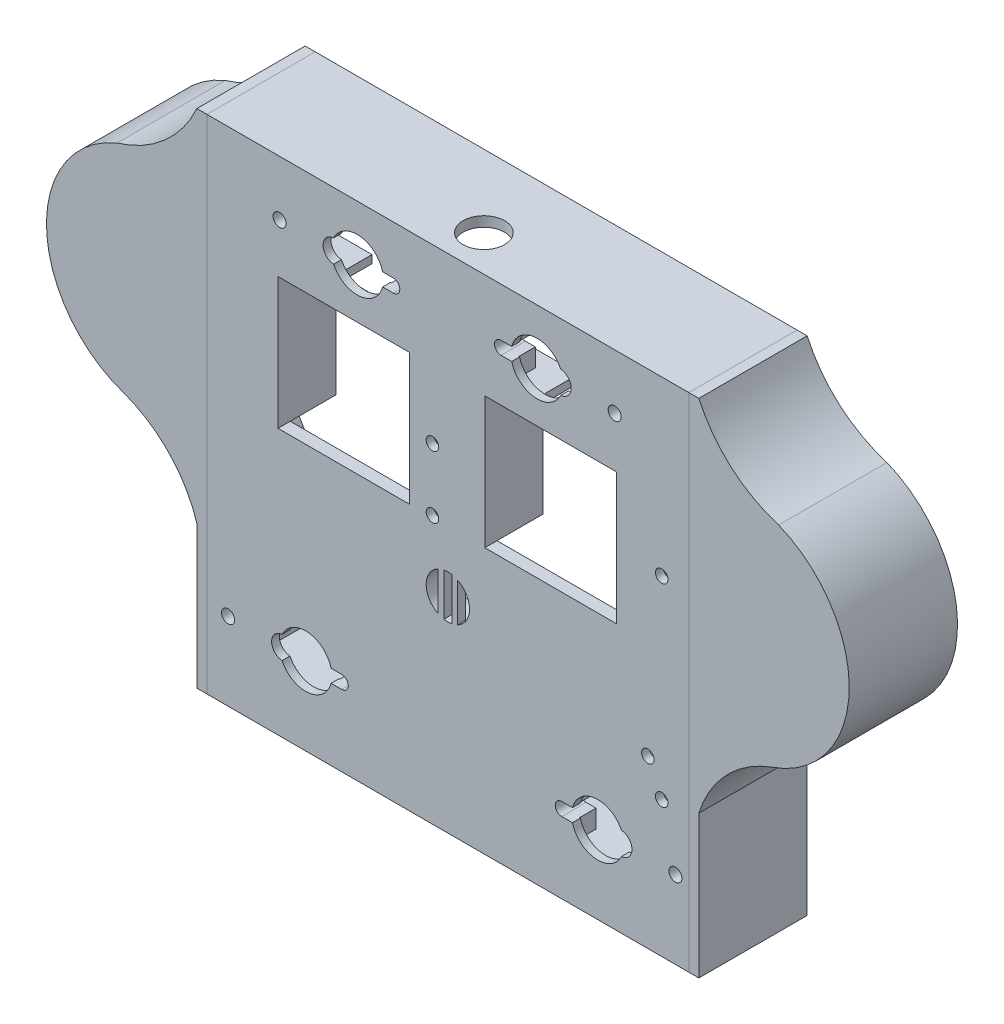
from build123d import *

# Parameters (mm, degrees)
SKETCH1_W                    = 127.00000000000001
SKETCH1_H                    = 127.00000000000001
BOSS_EXTRUDE1_DEPTH          = 2
BOSS_EXTRUDE2_DEPTH          = 2
BOSS_EXTRUDE3_START          = 25.4
BOSS_EXTRUDE3_DEPTH          = 25.4
CUT_EXTRUDE1_DEPTH           = 211.04755300039534
BOSS_EXTRUDE4_START          = -2
BOSS_EXTRUDE4_OUTLINE_W      = 33.269999999999996
BOSS_EXTRUDE4_OUTLINE_H      = 33.270000000000024
BOSS_EXTRUDE4_DEPTH          = 2
BOSS_EXTRUDE4_2_OUTLINE_W    = 5.079999999999998
BOSS_EXTRUDE4_2_OUTLINE_H    = 12.5
BOSS_EXTRUDE4_2_OUTLINE_W_2  = 5.080000000000027
BOSS_EXTRUDE4_2_OUTLINE_W_3  = 5.625874353
BOSS_EXTRUDE4_2_OUTLINE_H_2  = 12.499999999999998
BOSS_EXTRUDE4_2_OUTLINE_W_4  = 5.0800000000000125
BOSS_EXTRUDE4_2_OUTLINE_W_5  = 7.608246930999999
BOSS_EXTRUDE4_2_DEPTH        = 4.18
CUT_EXTRUDE5_START           = -6.18
CUT_EXTRUDE5_OUTLINE_R       = 1.651
CUT_EXTRUDE5_DEPTH           = 6.18
BOSS_EXTRUDE5_DEPTH          = 12.7
BOSS_EXTRUDE6_DEPTH          = 1.089599898
SKETCH14_W                   = 9.143999999999977
SKETCH14_H                   = 9.143999999999984
SKETCH14_R                   = 1.0921999999999987
SKETCH14_W_2                 = 7.387447767273962
SKETCH14_H_2                 = 9.143999999999977
SKETCH14_W_3                 = 7.351052232726062
SKETCH14_H_3                 = 9.143999999999991
SKETCH14_R_2                 = 1.092200000000002
BOSS_EXTRUDE8_DEPTH          = 9.598599898
BOSS_EXTRUDE10_START         = 4.064
BOSS_EXTRUDE10_OUTLINE_W     = 15.081000000000003
BOSS_EXTRUDE10_OUTLINE_H     = 2
BOSS_EXTRUDE10_DEPTH         = 8.636
BOSS_EXTRUDE10_2_OUTLINE_R   = 7.485
BOSS_EXTRUDE10_2_OUTLINE_R_2 = 5.485
BOSS_EXTRUDE10_2_DEPTH       = 5
CUT_EXTRUDE13_DEPTH          = 210.7960307571473
SKETCH18_W                   = 25.57999999999999
SKETCH18_H                   = 11.165
BOSS_EXTRUDE12_DEPTH         = 5
SKETCH23_W                   = 1.9050000000000011
SKETCH23_H                   = 11.165
BOSS_EXTRUDE14_DEPTH         = 2.54
SKETCH22_R                   = 5.2500000000000036
CUT_EXTRUDE14_DEPTH          = 209.52162027342368
SKETCH24_R                   = 1.5874999999999853
SKETCH24_R_2                 = 1.5874999999999986
CUT_EXTRUDE19_DEPTH          = 210.7960307571473
SKETCH25_R                   = 1.5874999999999986
SKETCH25_R_2                 = 1.5874999999999853
CUT_EXTRUDE20_DEPTH          = 210.7960307571473
SPLIT2_START                 = -27.4
SPLIT2_DEPTH                 = 27.4
SPLIT2_START_2               = -2
SPLIT2_2_DEPTH               = 2
SPLIT2_START_3               = -38.046098171
SPLIT2_3_DEPTH               = 40.586098171
SPLIT2_START_4               = 124.46
SPLIT2_4_DEPTH               = 40.586098171
SPLIT2_5_DEPTH               = 27.4
SPLIT2_6_DEPTH               = 2


# Read off the part's stored shape, not the designer's step: Boss-Extrude4, Cut-Extrude5, Boss-Extrude10, Split2
with BuildPart() as part:
    # Sketch1 → Boss-Extrude1 (new body)
    with BuildSketch(Plane.XY):
        with Locations((63.50000000000001, 63.50000000000001)):
            Rectangle(SKETCH1_W, SKETCH1_H)
    extrude(amount=-BOSS_EXTRUDE1_DEPTH)

    # Sketch4 → Boss-Extrude2 (add)
    with BuildSketch(Plane(origin=(0, 0, -2), x_dir=(-1, 0, 0), z_dir=(0, 0, -1))):
        with BuildLine():
            Line((-127, 109.98389429764997), (-127, 127))
            ThreePointArc((-127, 127), (-134.06423055053074, 117.00265834317705), (-144.33984712949783, 110.34969679238205))
            ThreePointArc((-144.3398471294978, 110.34969679238199), (-135.64173000356203, 111.50323268817304), (-127.00000000000034, 109.98389429764987))
        make_face()
        with BuildLine():
            Line((-127, 55.441382730095796), (-127, 109.98389429764997))
            ThreePointArc((-127.00000000000034, 109.98389429764987), (-135.64173000356203, 111.50323268817304), (-144.3398471294978, 110.34969679238199))
            ThreePointArc((-144.33984712949783, 110.34969679238205), (-145.75390374238242, 109.81636694945792), (-147.19134681661998, 109.34972550881787))
            ThreePointArc((-147.19134681661998, 109.34972550881787), (-165.03026565382407, 81.75785721819155), (-145.401924231689, 55.40892110942765))
            ThreePointArc((-145.401924231689, 55.40892110942765), (-136.1982993618574, 53.91568331925208), (-127.00000000000024, 55.44138273009586))
        make_face()
        with BuildLine():
            Line((-127, 109.98389429764997), (-127, 127))
            ThreePointArc((-127, 127), (-134.06423055053074, 117.00265834317705), (-144.33984712949783, 110.34969679238205))
            ThreePointArc((-144.3398471294978, 110.34969679238199), (-135.64173000356203, 111.50323268817304), (-127.00000000000034, 109.98389429764987))
        make_face()
        with BuildLine():
            Line((-127, 55.441382730095796), (-127, 109.98389429764997))
            ThreePointArc((-127.00000000000034, 109.98389429764987), (-135.64173000356203, 111.50323268817304), (-144.3398471294978, 110.34969679238199))
            ThreePointArc((-144.33984712949783, 110.34969679238205), (-145.75390374238242, 109.81636694945792), (-147.19134681661998, 109.34972550881787))
            ThreePointArc((-147.19134681661998, 109.34972550881787), (-165.03026565382407, 81.75785721819155), (-145.401924231689, 55.40892110942765))
            ThreePointArc((-145.401924231689, 55.40892110942765), (-136.1982993618574, 53.91568331925208), (-127.00000000000024, 55.44138273009586))
        make_face()
        with BuildLine():
            ThreePointArc((-145.401924231689, 55.40892110942764), (-133.95065083940247, 47.9093928466553), (-127, 36.11689356203695))
            Line((-127, 36.11689356203695), (-127, 55.441382730095796))
            ThreePointArc((-127.00000000000024, 55.44138273009586), (-136.1982993618574, 53.91568331925208), (-145.401924231689, 55.40892110942765))
        make_face()
    boss_extrude2 = extrude(amount=-BOSS_EXTRUDE2_DEPTH)

    # Mirror1: Boss-Extrude2 across plane
    add(boss_extrude2.mirror(Plane(origin=(63.5, 0, 0), x_dir=(0, 0, 1), z_dir=(1, 0, 0))))

    # Sketch5 → Boss-Extrude3 (add)
    with BuildSketch(Plane(origin=(0, 0, -2), x_dir=(-1, 0, 0), z_dir=(0, 0, -1)).offset(BOSS_EXTRUDE3_START)):
        with BuildLine():
            Line((0, 0), (0, 36.11689356203696))
            ThreePointArc((0, 36.11689356203696), (6.950650839402837, 47.909392846655656), (18.40192423168996, 55.40892110942798))
            ThreePointArc((18.40192423168996, 55.40892110942798), (38.03026565382408, 81.75785721819206), (20.191346816619987, 109.34972550881787))
            ThreePointArc((20.191346816619987, 109.34972550881787), (8.17850440054783, 115.98168301881103), (-3.47e-15, 127))
            Line((-3.47e-15, 127), (-127, 127))
            ThreePointArc((-127, 127), (-135.1785044005478, 115.98168301881103), (-147.19134681661998, 109.34972550881785))
            ThreePointArc((-147.19134681661998, 109.34972550881785), (-165.03026565382407, 81.75785721819206), (-145.40192423168997, 55.40892110942798))
            ThreePointArc((-145.40192423168997, 55.40892110942798), (-133.95065083940284, 47.90939284665566), (-127, 36.11689356203696))
            Line((-127, 36.11689356203696), (-127, 0))
            Line((-127, 0), (0, 0))
        make_face()
        with BuildLine():
            Line((-2.54, 2.54), (-2.54, 36.49717237208901))
            ThreePointArc((-2.54, 36.49717237208901), (4.988828741492426, 49.53196201137023), (17.56329445807016, 57.806731802829454))
            ThreePointArc((17.56329445807016, 57.806731802829454), (35.488998344648195, 81.76517459677275), (19.33789400089523, 106.95405447296278))
            ThreePointArc((19.33789400089523, 106.95405447296278), (7.086783976529961, 113.57345274602841), (-1.59591256392396, 124.46000000000001))
            Line((-1.59591256392396, 124.46000000000001), (-125.40408743607604, 124.46000000000001))
            ThreePointArc((-125.40408743607604, 124.46000000000001), (-134.08678397652994, 113.57345274602842), (-146.3378940008952, 106.95405447296281))
            ThreePointArc((-146.3378940008952, 106.95405447296281), (-162.48899834464805, 81.76517459677285), (-144.5632944580703, 57.8067318028295))
            ThreePointArc((-144.5632944580703, 57.8067318028295), (-131.98882874149245, 49.53196201137028), (-124.46000000000001, 36.49717237208901))
            Line((-124.46000000000001, 36.49717237208901), (-124.46000000000001, 2.54))
            Line((-124.46000000000001, 2.54), (-2.54, 2.54))
        make_face(mode=Mode.SUBTRACT)
    extrude(amount=-BOSS_EXTRUDE3_DEPTH)

    # Sketch6 → Cut-Extrude1 (cut, through all)
    with BuildSketch(Plane.XY):
        with BuildLine():
            ThreePointArc((92.05979136316081, 115.93690455448572), (79.45205223272606, 113.0648407726853), (92.05979136316081, 110.19277699088488))
            ThreePointArc((92.05979136316081, 110.19277699088488), (94.71405223272606, 113.0648407726853), (92.05979136316081, 115.93690455448572))
        make_face()
        with BuildLine():
            ThreePointArc((34.58631310229128, 110.1927769908849), (47.194052232726065, 113.0648407726853), (34.58631310229128, 115.93690455448572))
            ThreePointArc((34.58631310229128, 115.93690455448572), (31.932052232726047, 113.0648407726853), (34.58631310229128, 110.1927769908849))
        make_face()
        with BuildLine():
            ThreePointArc((21.556507801045413, 16.822606859552092), (34.1642469314802, 19.694670641352506), (21.556507801045413, 22.56673442315292))
            ThreePointArc((21.556507801045413, 22.56673442315292), (18.902246931480185, 19.694670641352506), (21.556507801045413, 16.822606859552092))
        make_face()
        with BuildLine():
            ThreePointArc((107.42586477707393, 22.566734423152884), (94.81812564663917, 19.69467064135247), (107.42586477707393, 16.822606859552057))
            ThreePointArc((107.42586477707393, 16.822606859552057), (110.08012564663916, 19.69467064135247), (107.42586477707393, 22.566734423152884))
        make_face()
    extrude(amount=-CUT_EXTRUDE1_DEPTH, mode=Mode.SUBTRACT)

    # Boss-Extrude4 outline → Boss-Extrude4 (cut)
    with BuildSketch(Plane(origin=(0, 0, -2), x_dir=(-1, 0, 0), z_dir=(0, 0, -1)).offset(BOSS_EXTRUDE4_START)):
        with Locations((-89.483052233, 83.829840773)):
            Rectangle(BOSS_EXTRUDE4_OUTLINE_W, BOSS_EXTRUDE4_OUTLINE_H)
        with Locations((-37.163052233, 83.829840773)):
            Rectangle(BOSS_EXTRUDE4_OUTLINE_W, BOSS_EXTRUDE4_OUTLINE_H)
    extrude(amount=BOSS_EXTRUDE4_DEPTH, mode=Mode.SUBTRACT)

    # Boss-Extrude4 2 outline → Boss-Extrude4 2 (add)
    with BuildSketch(Plane(origin=(0, 0, -2), x_dir=(-1, 0, 0), z_dir=(0, 0, -1))):
        with Locations((-20.638052233, 113.064840773)):
            Rectangle(BOSS_EXTRUDE4_2_OUTLINE_W, BOSS_EXTRUDE4_2_OUTLINE_H)
        with Locations((-49.734052233, 113.064840773)):
            Rectangle(BOSS_EXTRUDE4_2_OUTLINE_W, BOSS_EXTRUDE4_2_OUTLINE_H)
        with Locations((-76.912052233, 113.064840773)):
            Rectangle(BOSS_EXTRUDE4_2_OUTLINE_W, BOSS_EXTRUDE4_2_OUTLINE_H)
        with Locations((-106.008052233, 113.064840773)):
            Rectangle(BOSS_EXTRUDE4_2_OUTLINE_W_2, BOSS_EXTRUDE4_2_OUTLINE_H)
        with Locations((-121.6470628235, 19.694670641)):
            Rectangle(BOSS_EXTRUDE4_2_OUTLINE_W_3, BOSS_EXTRUDE4_2_OUTLINE_H_2)
        with Locations((-92.27812564700001, 19.694670641)):
            Rectangle(BOSS_EXTRUDE4_2_OUTLINE_W_4, BOSS_EXTRUDE4_2_OUTLINE_H_2)
        with Locations((-36.704246931, 19.694670641)):
            Rectangle(BOSS_EXTRUDE4_2_OUTLINE_W, BOSS_EXTRUDE4_2_OUTLINE_H_2)
        with Locations((-6.344123465499999, 19.694670641)):
            Rectangle(BOSS_EXTRUDE4_2_OUTLINE_W_5, BOSS_EXTRUDE4_2_OUTLINE_H_2)
    extrude(amount=BOSS_EXTRUDE4_2_DEPTH)

    # Cut-Extrude5 outline → Cut-Extrude5 (cut)
    with BuildSketch(Plane.XY.offset(CUT_EXTRUDE5_START)):
        with BuildLine():
            ThreePointArc((92.319125647, 21.345670641), (90.668125647, 19.694670641), (92.319125647, 18.043670641))
            Line((92.319125647, 18.043670641), (95.026948446, 18.043670641))
            ThreePointArc((95.026948446, 18.043670641), (94.818125647, 19.694670641), (95.026948446, 21.345670641))
            Line((95.026948446, 21.345670641), (92.319125647, 21.345670641))
        make_face()
        with BuildLine():
            ThreePointArc((36.663246931, 18.043670641), (38.314246931, 19.694670641), (36.663246931, 21.345670641))
            Line((36.663246931, 21.345670641), (33.955424132, 21.345670641))
            ThreePointArc((33.955424132, 21.345670641), (34.164246931, 19.694670641), (33.955424132, 18.043670641))
            Line((33.955424132, 18.043670641), (36.663246931, 18.043670641))
        make_face()
        with BuildLine():
            ThreePointArc((49.693052233, 111.413840773), (51.344052233, 113.064840773), (49.693052233, 114.715840773))
            Line((49.693052233, 114.715840773), (46.985229434, 114.715840773))
            ThreePointArc((46.985229434, 114.715840773), (47.194052233, 113.064840773), (46.985229434, 111.413840773))
            Line((46.985229434, 111.413840773), (49.693052233, 111.413840773))
        make_face()
        with Locations((121.079125647, 19.694670641)):
            Circle(CUT_EXTRUDE5_OUTLINE_R)
        with Locations((7.903246931, 19.694670641)):
            Circle(CUT_EXTRUDE5_OUTLINE_R)
        with Locations((20.933052233, 113.064840773)):
            Circle(CUT_EXTRUDE5_OUTLINE_R)
        with BuildLine():
            ThreePointArc((76.953052233, 114.715840773), (75.302052233, 113.064840773), (76.953052233, 111.413840773))
            Line((76.953052233, 111.413840773), (79.660875032, 111.413840773))
            ThreePointArc((79.660875032, 111.413840773), (79.452052233, 113.064840773), (79.660875032, 114.715840773))
            Line((79.660875032, 114.715840773), (76.953052233, 114.715840773))
        make_face()
        with Locations((105.713052233, 113.064840773)):
            Circle(CUT_EXTRUDE5_OUTLINE_R)
    extrude(amount=CUT_EXTRUDE5_DEPTH, mode=Mode.SUBTRACT)

    # Sketch12 → Boss-Extrude5 (add)
    with BuildSketch(Plane(origin=(0, 0, -2), x_dir=(-1, 0, 0), z_dir=(0, 0, -1))):
        Polygon((-72.84805223272609, 67.19484077268531), (-72.84805223272608, 100.46484077268529), (-106.11805223272609, 100.46484077268529), (-106.11805223272609, 67.1948407726853), (-108.11805223272609, 67.1948407726853), (-108.11805223272609, 102.46484077268529), (-70.84805223272609, 102.46484077268529), (-70.84805223272609, 67.19484077268531), align=None)
        Polygon((-20.528052232726047, 100.4648407726853), (-53.79805223272605, 100.4648407726853), (-53.79805223272604, 67.19484077268531), (-55.79805223272605, 67.19484077268531), (-55.79805223272606, 102.4648407726853), (-18.52805223272605, 102.4648407726853), (-18.52805223272605, 67.19484077268531), (-20.528052232726054, 67.19484077268531), align=None)
    extrude(amount=BOSS_EXTRUDE5_DEPTH)

    # Sketch13 → Boss-Extrude6 (add)
    with BuildSketch(Plane(origin=(0, 0, -2), x_dir=(-1, 0, 0), z_dir=(0, 0, -1))):
        Polygon((-55.79805223272605, 67.19484077268531), (-18.52805223272605, 67.19484077268531), (-18.528052232726047, 65.19484077268531), (-55.79805223272605, 65.19484077268531), align=None)
        Polygon((-108.11805223272609, 67.1948407726853), (-70.84805223272609, 67.19484077268531), (-70.84805223272609, 65.19484077268531), (-108.11805223272609, 65.19484077268531), align=None)
    extrude(amount=BOSS_EXTRUDE6_DEPTH)

    # Sketch14 → Boss-Extrude8 (add)
    # profile 1 of 4: a face of its own
    with BuildSketch(Plane(origin=(0, 0, -2), x_dir=(-1, 0, 0), z_dir=(0, 0, -1))):
        with Locations((-102.18305223272607, 52.47984077268529)):
            Rectangle(SKETCH14_W, SKETCH14_H)
        with Locations(Location((-102.18305223272607, 52.4798407726853, 0), (0, 0, 180))):
            Circle(SKETCH14_R, mode=Mode.SUBTRACT)
    # profile 2 of 4: a face of its own
    with BuildSketch(Plane(origin=(0, 0, -2), x_dir=(-1, 0, 0), z_dir=(0, 0, -1))):
        with Locations((-48.92127611636302, 52.47984077268531)):
            Rectangle(SKETCH14_W_2, SKETCH14_H_2)
        with Locations(Location((-49.86305223272605, 52.479840772685314, 0), (0, 0, 180))):
            Circle(SKETCH14_R, mode=Mode.SUBTRACT)
    # profile 3 of 4: a face of its own
    with BuildSketch(Plane(origin=(0, 0, -2), x_dir=(-1, 0, 0), z_dir=(0, 0, -1))):
        with Locations((-77.74302611636304, 52.47984077268529)):
            Rectangle(SKETCH14_W_3, SKETCH14_H_3)
        with Locations(Location((-76.78305223272606, 52.47984077268529, 0), (0, 0, 180))):
            Circle(SKETCH14_R, mode=Mode.SUBTRACT)
    # profile 4 of 4: a face of its own
    with BuildSketch(Plane(origin=(0, 0, -2), x_dir=(-1, 0, 0), z_dir=(0, 0, -1))):
        Polygon((-29.035052232726038, 57.051840772685296), (-19.891052232726054, 57.051840772685296), (-19.89105223272605, 47.90784077268531), (-29.035052232726038, 47.90784077268531), align=None)
        with Locations(Location((-24.463052232726042, 52.47984077268531, 0), (0, 0, 180))):
            Circle(SKETCH14_R_2, mode=Mode.SUBTRACT)
    extrude(amount=BOSS_EXTRUDE8_DEPTH)

    # Boss-Extrude10 outline → Boss-Extrude10 (cut)
    with BuildSketch(Plane(origin=(0, 0, -2), x_dir=(-1, 0, 0), z_dir=(0, 0, -1)).offset(BOSS_EXTRUDE10_START)):
        with Locations((-89.483052233, 101.46484077300002)):
            Rectangle(BOSS_EXTRUDE10_OUTLINE_W, BOSS_EXTRUDE10_OUTLINE_H)
        with Locations((-37.163052233, 101.46484077300002)):
            Rectangle(BOSS_EXTRUDE10_OUTLINE_W, BOSS_EXTRUDE10_OUTLINE_H)
    extrude(amount=BOSS_EXTRUDE10_DEPTH, mode=Mode.SUBTRACT)

    # Boss-Extrude10 2 outline → Boss-Extrude10 2 (add)
    with BuildSketch(Plane(origin=(0, 0, -2), x_dir=(-1, 0, 0), z_dir=(0, 0, -1))):
        with Locations((-63.5, 51.755072775)):
            Circle(BOSS_EXTRUDE10_2_OUTLINE_R)
        with Locations((-63.5, 51.755072775)):
            Circle(BOSS_EXTRUDE10_2_OUTLINE_R_2, mode=Mode.SUBTRACT)
    extrude(amount=BOSS_EXTRUDE10_2_DEPTH)

    # Sketch21 → Cut-Extrude13 (cut, through all)
    with BuildSketch(Plane(origin=(0, 0, -2), x_dir=(-1, 0, 0), z_dir=(0, 0, -1))):
        with BuildLine():
            Line((-66, 46.87293953267781), (-66, 56.637206018184976))
            ThreePointArc((-66.00000000000003, 56.63720601818498), (-67.10723493181816, 55.88703128764697), (-67.9999999999999, 54.89118900414498))
            Line((-68, 54.891189004145), (-68, 48.61895654671779))
            ThreePointArc((-67.99999999999991, 48.61895654671782), (-67.10723493181816, 47.62311426321582), (-66.00000000000003, 46.872939532677805))
        make_face()
        with BuildLine():
            ThreePointArc((-62.50000000000007, 57.148144720065545), (-63.50000000000009, 57.24007277543138), (-64.5000000000001, 57.14814472006552))
            Line((-64.5, 57.148144720065496), (-64.5, 46.36200083079729))
            ThreePointArc((-64.5000000000001, 46.36200083079727), (-63.500000000000085, 46.27007277543141), (-62.500000000000064, 46.36200083079724))
            Line((-62.5, 46.36200083079723), (-62.5, 57.14814472006556))
        make_face()
        with BuildLine():
            ThreePointArc((-58.999999999999986, 54.89118900414482), (-59.89276506818183, 55.88703128764695), (-61.00000000000008, 56.63720601818504))
            Line((-61, 56.63720601818507), (-61, 46.87293953267773))
            ThreePointArc((-61.00000000000007, 46.87293953267775), (-59.89276506818182, 47.62311426321584), (-58.999999999999986, 48.61895654671796))
            Line((-59.000000000000014, 48.618956546717975), (-59.000000000000014, 54.89118900414481))
        make_face()
        with BuildLine():
            ThreePointArc((-58.015000000000015, 51.755072775431394), (-58.26704075116193, 53.39865499120276), (-58.999999999999986, 54.89118900414482))
            Line((-59.000000000000014, 54.89118900414481), (-59.000000000000014, 48.618956546717975))
            ThreePointArc((-58.999999999999986, 48.61895654671796), (-58.26704075116193, 50.11149055966002), (-58.015000000000015, 51.755072775431394))
        make_face()
        with BuildLine():
            Line((-68, 48.61895654671779), (-68, 54.891189004145))
            ThreePointArc((-67.9999999999999, 54.89118900414498), (-68.98499999999999, 51.755072775431394), (-67.99999999999991, 48.61895654671782))
        make_face()
    extrude(amount=-CUT_EXTRUDE13_DEPTH, mode=Mode.SUBTRACT)

    # Sketch18 → Boss-Extrude12 (add)
    with BuildSketch(Plane(origin=(0, 0, -2), x_dir=(-1, 0, 0), z_dir=(0, 0, -1))):
        with Locations((-63.5, 40.68757277543139)):
            Rectangle(SKETCH18_W, SKETCH18_H)
    extrude(amount=BOSS_EXTRUDE12_DEPTH)

    # Sketch23 → Boss-Extrude14 (add)
    with BuildSketch(Plane(origin=(0, 0, -7), x_dir=(-1, 0, 0), z_dir=(0, 0, -1))):
        with Locations((-75.33749999999999, 40.68757277543139)):
            Rectangle(SKETCH23_W, SKETCH23_H)
        with Locations((-51.6625, 40.68757277543139)):
            Rectangle(SKETCH23_W, SKETCH23_H)
    extrude(amount=BOSS_EXTRUDE14_DEPTH)

    # Sketch22 → Cut-Extrude14 (cut, through all)
    with BuildSketch(Plane.XZ.offset(-124.46000000000001)):
        with Locations(Location((63.5, -9.111999999999997, 0), (0, 0, 270))):
            Circle(SKETCH22_R)
    extrude(amount=-CUT_EXTRUDE14_DEPTH, mode=Mode.SUBTRACT)

    # Sketch24 → Cut-Extrude19 (cut, through all)
    with BuildSketch(Plane(origin=(0, 0, -2), x_dir=(-1, 0, 0), z_dir=(0, 0, -1))):
        with Locations((-117.60805223272605, 83.38400839159783)):
            Circle(SKETCH24_R)
        with Locations((-117.60805223272605, 34.38400839159783)):
            Circle(SKETCH24_R)
        with Locations((-59.60805223272605, 83.38400839159782)):
            Circle(SKETCH24_R_2)
    extrude(amount=-CUT_EXTRUDE19_DEPTH, mode=Mode.SUBTRACT)

    # Sketch25 → Cut-Extrude20 (cut, through all)
    with BuildSketch(Plane(origin=(0, 0, -2), x_dir=(-1, 0, 0), z_dir=(0, 0, -1))):
        with Locations((-59.60805223272604, 67.66400000000002)):
            Circle(SKETCH25_R)
        with Locations((-114.10805223272608, 42.164)):
            Circle(SKETCH25_R_2)
    extrude(amount=-CUT_EXTRUDE20_DEPTH, mode=Mode.SUBTRACT)

    # Split2 3 outline → Split2 3 (cut)
    with BuildSketch(Plane.YZ.offset(SPLIT2_START_3)):
        Polygon((127, 0), (0, 0), (0, -27.4), (124.46, -27.4), (127, -27.4), align=None)
    extrude(amount=SPLIT2_3_DEPTH, mode=Mode.SUBTRACT)

    # Split2 4 outline → Split2 4 (cut)
    with BuildSketch(Plane.YZ.offset(SPLIT2_START_4)):
        Polygon((127, 0), (0, 0), (0, -27.4), (124.46, -27.4), (127, -27.4), align=None)
    extrude(amount=SPLIT2_4_DEPTH, mode=Mode.SUBTRACT)


with BuildPart() as body_2:
    # Split2 outline → Split2 (new body)
    with BuildSketch(Plane.XY.offset(SPLIT2_START)):
        with BuildLine():
            Line((127, 127), (124.46, 127))
            Line((124.46, 127), (124.46, 124.46))
            Line((124.46, 124.46), (125.404087436, 124.46))
            ThreePointArc((125.404087436, 124.46), (134.086783977, 113.573452746), (146.337894001, 106.954054473))
            ThreePointArc((146.337894001, 106.954054473), (162.488998345, 81.765174597), (144.563294458, 57.806731803))
            ThreePointArc((144.563294458, 57.806731803), (131.988828741, 49.531962011), (124.46, 36.497172372))
            Line((124.46, 36.497172372), (124.46, 0))
            Line((124.46, 0), (127, 0))
            Line((127, 0), (127, 36.116893562))
            ThreePointArc((127, 36.116893562), (133.950650839, 47.909392847), (145.401924232, 55.408921109))
            ThreePointArc((145.401924232, 55.408921109), (165.030265654, 81.757857218), (147.191346817, 109.349725509))
            ThreePointArc((147.191346817, 109.349725509), (135.178504401, 115.981683019), (127, 127))
        make_face()
    extrude(amount=SPLIT2_DEPTH)

    # Split2 2 outline → Split2 2 (add)
    with BuildSketch(Plane.XY.offset(SPLIT2_START_2)):
        with BuildLine():
            Line((125.404087436, 124.46), (124.46, 124.46))
            Line((124.46, 124.46), (124.46, 36.497172372))
            ThreePointArc((124.46, 36.497172372), (131.988828741, 49.531962011), (144.563294458, 57.806731803))
            ThreePointArc((144.563294458, 57.806731803), (162.488998345, 81.765174597), (146.337894001, 106.954054473))
            ThreePointArc((146.337894001, 106.954054473), (134.086783977, 113.573452746), (125.404087436, 124.46))
        make_face()
    extrude(amount=SPLIT2_2_DEPTH)


with BuildPart() as body_3:
    # Split2 5 outline → Split2 5 (new body)
    with BuildSketch(Plane.XY.offset(SPLIT2_START)):
        with BuildLine():
            Line((0, 0), (2.54, 0))
            Line((2.54, 0), (2.54, 36.497172372))
            ThreePointArc((2.54, 36.497172372), (-4.988828741, 49.531962011), (-17.563294458, 57.806731803))
            ThreePointArc((-17.563294458, 57.806731803), (-35.488998345, 81.765174597), (-19.337894001, 106.954054473))
            ThreePointArc((-19.337894001, 106.954054473), (-7.086783977, 113.573452746), (1.595912564, 124.46))
            Line((1.595912564, 124.46), (2.54, 124.46))
            Line((2.54, 124.46), (2.54, 127))
            Line((2.54, 127), (0, 127))
            ThreePointArc((0, 127), (-8.178504401, 115.981683019), (-20.191346817, 109.349725509))
            ThreePointArc((-20.191346817, 109.349725509), (-38.030265654, 81.757857218), (-18.401924232, 55.408921109))
            ThreePointArc((-18.401924232, 55.408921109), (-6.950650839, 47.909392847), (0, 36.116893562))
            Line((0, 36.116893562), (0, 0))
        make_face()
    extrude(amount=SPLIT2_5_DEPTH)

    # Split2 6 outline → Split2 6 (add)
    with BuildSketch(Plane.XY.offset(SPLIT2_START_2)):
        with BuildLine():
            ThreePointArc((-17.563294458, 57.806731803), (-4.988828741, 49.531962011), (2.54, 36.497172372))
            Line((2.54, 36.497172372), (2.54, 124.46))
            Line((2.54, 124.46), (1.595912564, 124.46))
            ThreePointArc((1.595912564, 124.46), (-7.086783977, 113.573452746), (-19.337894001, 106.954054473))
            ThreePointArc((-19.337894001, 106.954054473), (-35.488998345, 81.765174597), (-17.563294458, 57.806731803))
        make_face()
    extrude(amount=SPLIT2_6_DEPTH)


solid = Compound([part.part, body_2.part, body_3.part])
